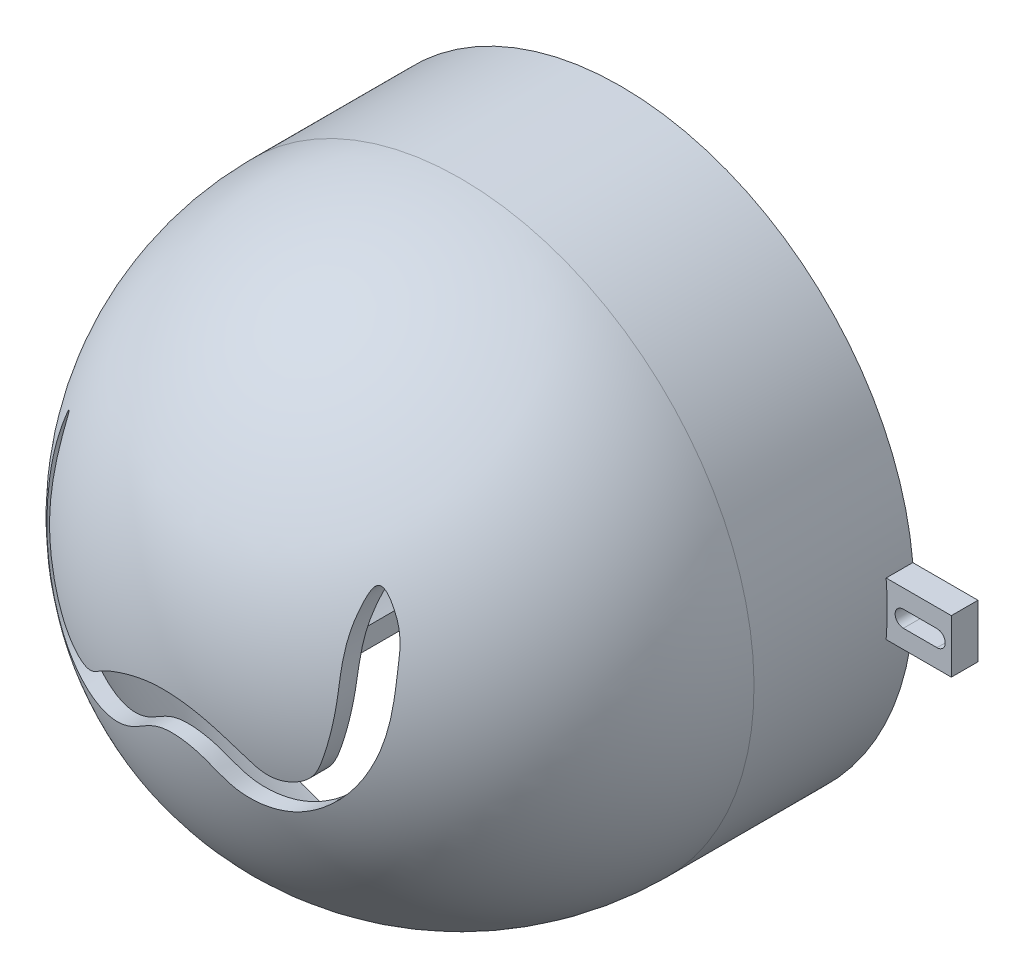
from build123d import *

# Parameters (mm, degrees)
SHELL1_T                = 3
SKETCH5_W               = 64
SKETCH5_H               = 41
CUT_EXTRUDE2_DEPTH      = 167.823126193
CUT_EXTRUDE3_DEPTH      = 112.579568022
CUT_EXTRUDE3_DEPTH_BACK = 112.579568022
BOSS_EXTRUDE1_DEPTH     = 5
CUT_EXTRUDE4_DEPTH      = 5


with BuildPart() as part:
    # Sketch2 → Revolve1 (revolve)
    with BuildSketch(Plane(origin=(0, 0, 0), x_dir=(0, 0, -1), z_dir=(1, 0, 0))):
        with BuildLine():
            Line((65.580335522, 0), (147.580335522, 0))
            Line((147.580335522, 0), (147.580335522, 52))
            Line((147.580335522, 52), (117.580335522, 52))
            ThreePointArc((117.580335522, 52), (80.810782901, 36.769552622), (65.580335522, 0))
        make_face()
    revolve(axis=Axis((0, 0, -65.580335522), (0, 0, 1)))

    # Shell1
    shell1_openings = [part.faces().sort_by_distance(p)[0] for p in [
        (0, 0, -147.580335522),
    ]]
    offset(amount=SHELL1_T, openings=shell1_openings, kind=Kind.INTERSECTION)

    # Sketch5 → Cut-Extrude2 (cut, through all)
    with BuildSketch(Plane(origin=(0, 0, 0), x_dir=(1, 0, 0), z_dir=(0, 1, 0))):
        with Locations((0, 127.080335522)):
            Rectangle(SKETCH5_W, SKETCH5_H)
    extrude(amount=-CUT_EXTRUDE2_DEPTH, mode=Mode.SUBTRACT)

    # Sketch6 → Cut-Extrude3 (cut, two sides: drawn at the far end of the back side and taken through both)
    with BuildSketch(Plane(origin=(0, 0, -67.580335522), x_dir=(-1, 0, 0), z_dir=(0, 0, -1)).offset(-CUT_EXTRUDE3_DEPTH_BACK)):
        with BuildLine():
            add(Edge.make_bspline(
                [(36.140801008, 18.027879703), (35.269124225, 19.032045383), (35.909596292, 5.571753445), (31.589529753, -1.50195931), (25.969497821, -8.38330943), (18.739142168, -9.382269286), (14.752185658, -5.83813129), (9.736307056, -2.917242373), (3.280179801, -0.531869579), (-5.04470811, -1.071997565), (-11.30505895, -4.59296331), (-16.507919354, -9.090558842), (-22.140383545, -7.193888288), (-24.349118776, -1.080465506), (-25.822090118, 8.452799747), (-24.495129296, 15.748899133), (-26.440801485, 24.816437965), (-30.816901201, 18.702584197), (-31.512219621, 13.396700874), (-31.975601305, 5.210517435), (-30.082841776, -2.50830582), (-25.514237588, -9.951413458), (-18.196201159, -14.962700451), (-9.990222069, -13.270458046), (-5.59500651, -8.301955069), (2.271735144, -6.721550917), (8.078824021, -12.052191068), (15.586162456, -14.997298671), (22.787291195, -14.491095308), (29.182309348, -11.595750058), (32.775437054, -6.764909505), (35.977728885, -1.173051514), (37.47088774, 5.45488164), (38.347067145, 11.250949495), (36.597330488, 17.501960871), (36.140801008, 18.027879703)],
                knots=[0, 0, 0, 0, 0.047543429, 0.086529045, 0.127342843, 0.150207288, 0.169697513, 0.191841006, 0.224466056, 0.255221812, 0.294002634, 0.315120585, 0.337437525, 0.355618522, 0.394721257, 0.455796313, 0.466208554, 0.484862333, 0.513640823, 0.548093023, 0.583361237, 0.613542404, 0.658236936, 0.684746801, 0.711698492, 0.740676518, 0.774664954, 0.805471379, 0.841451266, 0.862828306, 0.892573372, 0.915409278, 0.944999839, 0.975099742, 1, 1, 1, 1], degree=3))
        make_face()
    extrude(amount=CUT_EXTRUDE3_DEPTH + CUT_EXTRUDE3_DEPTH_BACK, mode=Mode.SUBTRACT)

    # Sketch7 → Boss-Extrude1 (add)
    with BuildSketch(Plane(origin=(0, 0, -147.580335522), x_dir=(-1, 0, 0), z_dir=(0, 0, -1))):
        Polygon((-67, 0), (-67, 5), (-51.759057178, 5), (-52, 0), (-51.759057178, -5), (-67, -5), align=None)
        Polygon((51.759057178, -5), (67, -5), (67, 0), (67, 5), (51.759057178, 5), (52, 0), align=None)
    extrude(amount=-BOSS_EXTRUDE1_DEPTH)

    # Sketch8 → Cut-Extrude4 (cut)
    with BuildSketch(Plane(origin=(0, 0, -147.580335522), x_dir=(-1, 0, 0), z_dir=(0, 0, -1))):
        with BuildLine():
            Line((-64.309643632, 1.55), (-58.006778026, 1.55))
            ThreePointArc((-58.006778026, 1.55), (-56.456778026, 0), (-58.006778026, -1.55))
            Line((-58.006778026, -1.55), (-64.309643632, -1.55))
            ThreePointArc((-64.309643632, -1.55), (-65.859643632, 0), (-64.309643632, 1.55))
        make_face()
        with BuildLine():
            Line((64.309643632, 1.55), (58.006778026, 1.55))
            ThreePointArc((58.006778026, 1.55), (56.456778026, 0), (58.006778026, -1.55))
            Line((58.006778026, -1.55), (64.309643632, -1.55))
            ThreePointArc((64.309643632, -1.55), (65.859643632, 0), (64.309643632, 1.55))
        make_face()
    extrude(amount=-CUT_EXTRUDE4_DEPTH, mode=Mode.SUBTRACT)


solid = part.part
